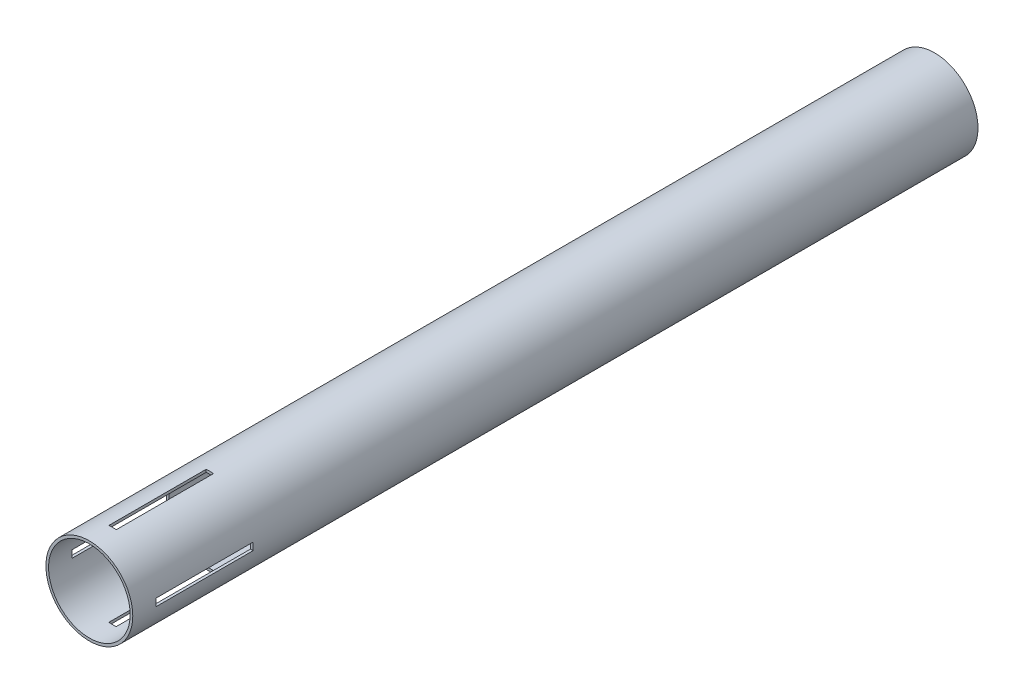
from build123d import *

# Parameters (mm, degrees)
SKETCH1_R           = 20.555
SKETCH1_R_2         = 19.305
BOSS_EXTRUDE3_DEPTH = 400
SKETCH2_W           = 3.5
SKETCH2_H           = 46
CUT_EXTRUDE1_DEPTH  = 402.0548791
CIRPATTERN1_COUNT   = 2
CIRPATTERN1_ANGLE   = 90


with BuildPart() as part:
    # Sketch1 → Boss-Extrude3 (new body)
    with BuildSketch(Plane.XY):
        Circle(SKETCH1_R)
        Circle(SKETCH1_R_2, mode=Mode.SUBTRACT)
    extrude(amount=-BOSS_EXTRUDE3_DEPTH)

    # Sketch2 → Cut-Extrude1 (cut, symmetric)
    with BuildSketch(Plane(origin=(0, 0, 0), x_dir=(1, 0, 0), z_dir=(0, 1, 0))):
        with Locations((0, 34)):
            Rectangle(SKETCH2_W, SKETCH2_H)
    cut_extrude1 = extrude(amount=CUT_EXTRUDE1_DEPTH, both=True, mode=Mode.SUBTRACT)

    # CirPattern1: Cut-Extrude1 ×2 about axis
    cirpattern1_axis = Axis((0, 0, -400), (0, 0, -1))
    for i in range(1, CIRPATTERN1_COUNT):
        add(cut_extrude1.rotate(cirpattern1_axis, i * CIRPATTERN1_ANGLE / (CIRPATTERN1_COUNT - 1)), mode=Mode.SUBTRACT)


solid = part.part
